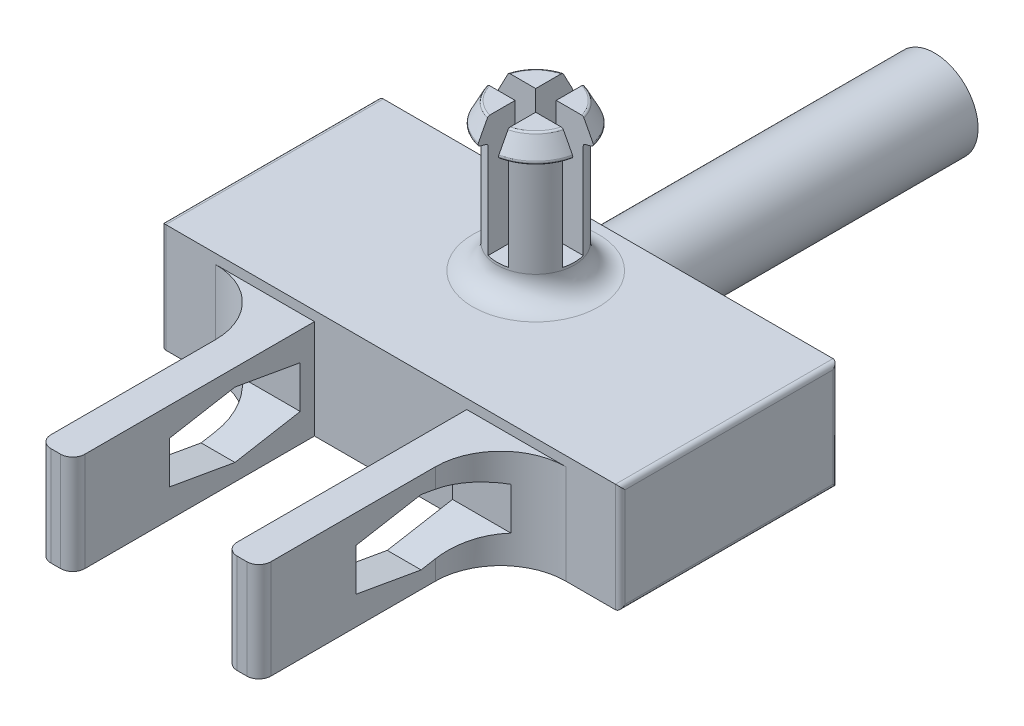
from build123d import *

# Parameters (mm, degrees)
DODANIE_WYCI_GNI_CIE1_DEPTH     = 4.5
DODANIE_WYCI_GNI_CIE2_DEPTH     = 4.1
SZKIC2_R                        = 1.8
DODANIE_WYCI_GNI_CIE3_DEPTH     = 13.5
WYTNIJ_WYCI_GNI_CIE2_DEPTH      = 23.456012558
WYTNIJ_WYCI_GNI_CIE2_DEPTH_BACK = 23.456012558
ZAOKR_GLENIE1_R                 = 0.5
ZAOKR_GLENIE2_R                 = 0.2
SZKIC4_R                        = 1.6
DODANIE_WYCI_GNI_CIE4_DEPTH     = 5.1
SZKIC5_R                        = 1.6
DODANIE_WYCI_GNI_CIE5_DEPTH     = 1
ZAOKR_GLENIE4_R                 = 1
ZAOKR_GLENIE5_R                 = 0.1
WYTNIJ_WYCI_GNI_CIE3_DEPTH      = 5


with BuildPart() as part:
    # Szkic1 → Dodanie-wyciągnięcie1 (new body)
    with BuildSketch(Plane(origin=(0, 0, 0), x_dir=(1, 0, 0), z_dir=(0, 1, 0))):
        Polygon((3.15, -4.5), (4.55, -4.5), (7.25, -4.5), (9.5, -4.5), (9.5, 4.5), (2.579268293, 4.5), (-2.579268293, 4.5), (-9.5, 4.5), (-9.5, -4.5), (-7.25, -4.5), (-4.55, -4.5), (-3.15, -4.5), align=None)
    extrude(amount=DODANIE_WYCI_GNI_CIE1_DEPTH)

    # Szkic1<7> → Dodanie-wyciągnięcie2 (add)
    with BuildSketch(Plane(origin=(0, 0, 0), x_dir=(1, 0, 0), z_dir=(0, 1, 0))):
        with BuildLine():
            Line((4.55, -14.5), (4.55, -7.2))
            ThreePointArc((4.55, -7.2), (5.340811691, -5.290811691), (7.25, -4.5))
            Line((7.25, -4.5), (3.15, -4.5))
            Line((3.15, -4.5), (3.15, -14.5))
            Line((3.15, -14.5), (4.55, -14.5))
        make_face()
        with BuildLine():
            Line((-3.15, -14.5), (-3.15, -4.5))
            Line((-3.15, -4.5), (-7.25, -4.5))
            ThreePointArc((-7.25, -4.5), (-5.340811691, -5.290811691), (-4.55, -7.2))
            Line((-4.55, -7.2), (-4.55, -14.5))
            Line((-4.55, -14.5), (-3.15, -14.5))
        make_face()
    extrude(amount=DODANIE_WYCI_GNI_CIE2_DEPTH)

    # Szkic2 → Dodanie-wyciągnięcie3 (add)
    with BuildSketch(Plane(origin=(0, 0, -4.5), x_dir=(-1, 0, 0), z_dir=(0, 0, -1))):
        with Locations((0, 2.25)):
            Circle(SZKIC2_R)
    extrude(amount=DODANIE_WYCI_GNI_CIE3_DEPTH)

    # Szkic3 → Wytnij-wyciągnięcie2 (cut, two sides: drawn at the far end of the back side and taken through both)
    with BuildSketch(Plane(origin=(-3.15, 0, 0), x_dir=(0, 0, -1), z_dir=(1, 0, 0)).offset(-WYTNIJ_WYCI_GNI_CIE2_DEPTH_BACK)):
        Polygon((-7.790001582, 3.4), (-10.490001582, 2.923917152), (-10.490001582, 1.176082848), (-7.790001582, 0.7), (-5.090001582, 1.176082848), (-5.090001582, 2.923917152), align=None)
    extrude(amount=WYTNIJ_WYCI_GNI_CIE2_DEPTH + WYTNIJ_WYCI_GNI_CIE2_DEPTH_BACK, mode=Mode.SUBTRACT)

    # Zaokrąglenie1
    zaokr_glenie1_edges = [part.edges().sort_by_distance(p)[0] for p in [
        (3.15, 2.05, 14.5),
        (4.55, 2.05, 14.5),
        (-4.55, 2.05, 14.5),
        (-3.15, 2.05, 14.5),
    ]]
    fillet(zaokr_glenie1_edges, radius=ZAOKR_GLENIE1_R)

    # Zaokrąglenie2
    zaokr_glenie2_edges = [part.edges().sort_by_distance(p)[0] for p in [
        (-9.5, 2.25, -4.5),
        (-9.5, 4.5, 0),
        (9.5, 0, 0),
        (-9.5, 2.25, 4.5),
        (9.5, 2.25, 4.5),
        (9.5, 2.25, -4.5),
        (9.5, 4.5, 0),
        (-9.5, 0, 0),
    ]]
    fillet(zaokr_glenie2_edges, radius=ZAOKR_GLENIE2_R)

    # Szkic4 → Dodanie-wyciągnięcie4 (add)
    with BuildSketch(Plane(origin=(0, 4.5, 0), x_dir=(1, 0, 0), z_dir=(0, 1, 0))):
        with Locations((0, 1.5)):
            Circle(SZKIC4_R)
    extrude(amount=DODANIE_WYCI_GNI_CIE4_DEPTH)

    # Szkic5 → Dodanie-wyciągnięcie5 (add)
    with BuildSketch(Plane(origin=(0, 9.6, 0), x_dir=(1, 0, 0), z_dir=(0, 1, 0))):
        with Locations((0, 1.5)):
            Circle(SZKIC5_R)
    extrude(amount=DODANIE_WYCI_GNI_CIE5_DEPTH)

    # Zaokrąglenie4
    zaokr_glenie4_edges = [part.edges().sort_by_distance(p)[0] for p in [
        (-1.6, 4.5, -1.5),
    ]]
    fillet(zaokr_glenie4_edges, radius=ZAOKR_GLENIE4_R)

    # Szkic7 → Obrót1 (revolve)
    with BuildSketch(Plane(origin=(0, 0, 0), x_dir=(0, 0, -1), z_dir=(1, 0, 0))):
        Polygon((3.1, 10.6), (3.1, 9.6), (3.55, 9.720577137), align=None)
    revolve(axis=Axis((0, 9.6, -1.5), (0, -1, 0)))

    # Zaokrąglenie5
    zaokr_glenie5_edges = [part.edges().sort_by_distance(p)[0] for p in [
        (-1.13137085, 9.6, -0.36862915),
        (0, 9.720577137, 0.55),
        (0, 10.6, 0.1),
    ]]
    fillet(zaokr_glenie5_edges, radius=ZAOKR_GLENIE5_R)

    # Szkic6 → Wytnij-wyciągnięcie3 (cut)
    with BuildSketch(Plane(origin=(0, 10.6, 0), x_dir=(1, 0, 0), z_dir=(0, 1, 0))):
        with BuildLine():
            Line((0.425, 4.714465969), (0.425, 1.925))
            Line((0.425, 1.925), (3.214465969, 1.925))
            ThreePointArc((3.214465969, 1.925), (3.242439894, 1.5), (3.214465969, 1.075))
            Line((3.214465969, 1.075), (0.425, 1.075))
            Line((0.425, 1.075), (0.425, -1.714465969))
            ThreePointArc((0.425, -1.714465969), (0, -1.742439894), (-0.425, -1.714465969))
            Line((-0.425, -1.714465969), (-0.425, 1.075))
            Line((-0.425, 1.075), (-3.214465969, 1.075))
            ThreePointArc((-3.214465969, 1.075), (-3.242439894, 1.5), (-3.214465969, 1.925))
            Line((-3.214465969, 1.925), (-0.425, 1.925))
            Line((-0.425, 1.925), (-0.425, 4.714465969))
            ThreePointArc((-0.425, 4.714465969), (0, 4.742439894), (0.425, 4.714465969))
        make_face()
    extrude(amount=-WYTNIJ_WYCI_GNI_CIE3_DEPTH, mode=Mode.SUBTRACT)


solid = part.part
